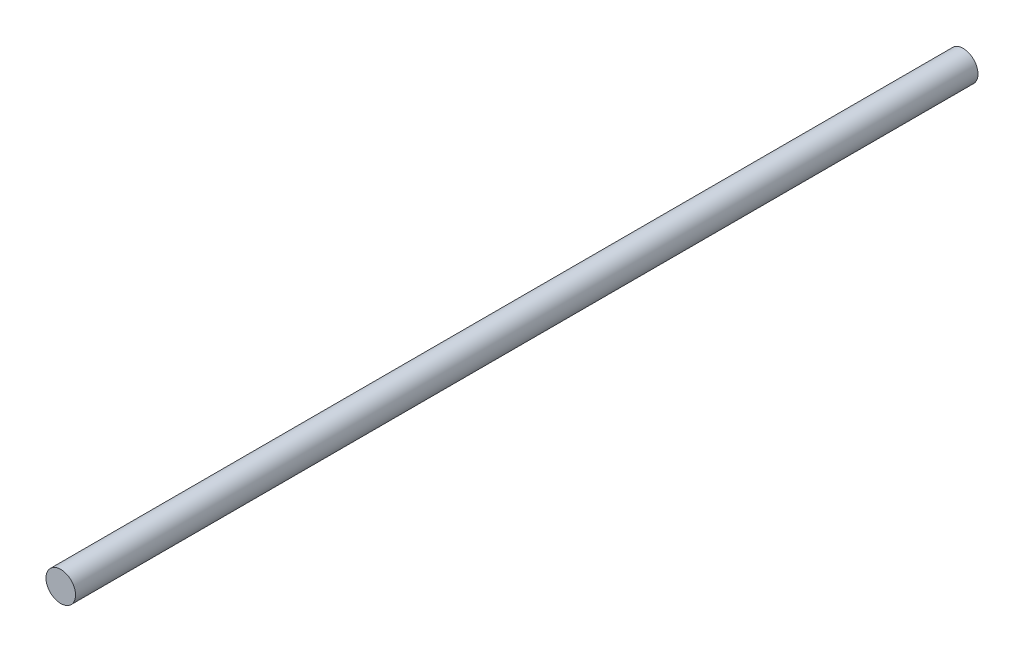
from build123d import *

# Parameters (mm, degrees)
SKETCH1_R           = 10
BOSS_EXTRUDE1_DEPTH = 610


with BuildPart() as part:
    # Sketch1 → Boss-Extrude1 (new body)
    with BuildSketch(Plane.XY):
        Circle(SKETCH1_R)
    extrude(amount=BOSS_EXTRUDE1_DEPTH)


solid = part.part
